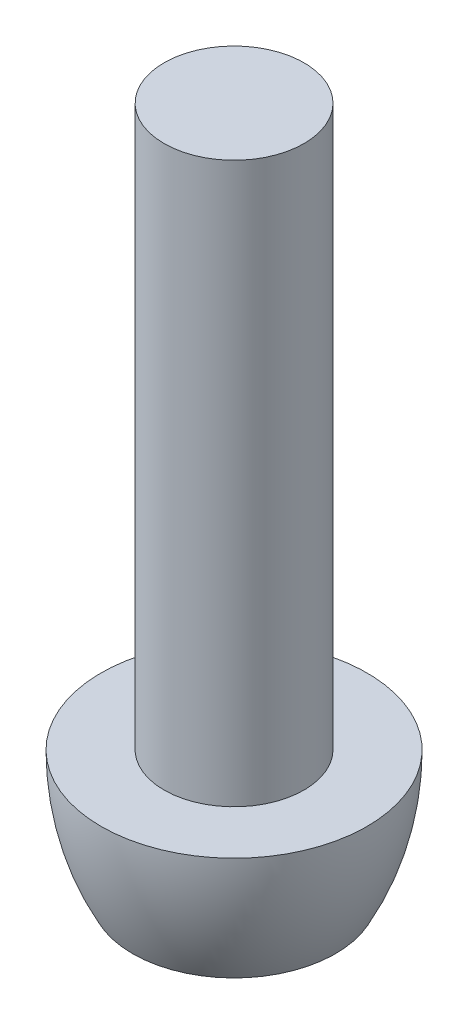
from build123d import *

# Parameters (mm, degrees)
SKETCH_1_R          = 1
EXTRUDE_375_DEPTH   = 8
EXTRUDE_START       = -1.8
SKETCH_1_3_R        = 1.9
SKETCH_1_3_R_2      = 1
EXTRUDE_453_DEPTH   = 1.8
CUT_EXTRUDE_1_DEPTH = 0.6


with BuildPart() as part:
    # 草图1 → Extrude 375 (new body)
    with BuildSketch(Plane(origin=(0, 0, 0), x_dir=(1, 0, 0), z_dir=(0, 1, 0))):
        with Locations(Location((0, 0, 0), (0, 0, 270))):
            Circle(SKETCH_1_R)
    extrude(amount=EXTRUDE_375_DEPTH)

    # 草图1<3> → Extrude 453 (add)
    # profile 1 of 2: a face of its own
    with BuildSketch(Plane(origin=(0, 0, 0), x_dir=(1, 0, 0), z_dir=(0, 1, 0)).offset(EXTRUDE_START)):
        with Locations(Location((0, 0, 0), (0, 0, 270))):
            Circle(SKETCH_1_3_R)
        with Locations(Location((0, 0, 0), (0, 0, 270))):
            Circle(SKETCH_1_3_R_2, mode=Mode.SUBTRACT)
    # profile 2 of 2: a face of its own
    with BuildSketch(Plane(origin=(0, 0, 0), x_dir=(1, 0, 0), z_dir=(0, 1, 0)).offset(EXTRUDE_START)):
        with Locations(Location((0, 0, 0), (0, 0, 270))):
            Circle(SKETCH_1_3_R_2)
    extrude(amount=EXTRUDE_453_DEPTH)

    # 草图2 → 切除-旋转1 (revolve, cut)
    with BuildSketch(Plane.XY, mode=Mode.PRIVATE) as cut_revolve_1_sk:
        with BuildLine():
            Line((-1.9, 0), (-1.9, -1.8))
            Line((-1.9, -1.8), (-1.45, -1.8))
            ThreePointArc((-1.45, -1.8), (-1.785795063, -0.927698766), (-1.9, 0))
        make_face()
    revolve(cut_revolve_1_sk.sketch.rotate(Axis((0, 0, 0), (0, 1, 0)), 90), axis=Axis((0, 0, 0), (0, 1, 0)), mode=Mode.SUBTRACT)

    # 草图3 → 切除-拉伸1 (cut)
    with BuildSketch(Plane.XZ.offset(1.8)):
        Polygon((-0.288675135, -0.5), (0.288675135, -0.5), (0.577350269, 0), (0.288675135, 0.5), (-0.288675135, 0.5), (-0.577350269, 0), align=None)
    extrude(amount=-CUT_EXTRUDE_1_DEPTH, mode=Mode.SUBTRACT)


solid = part.part
